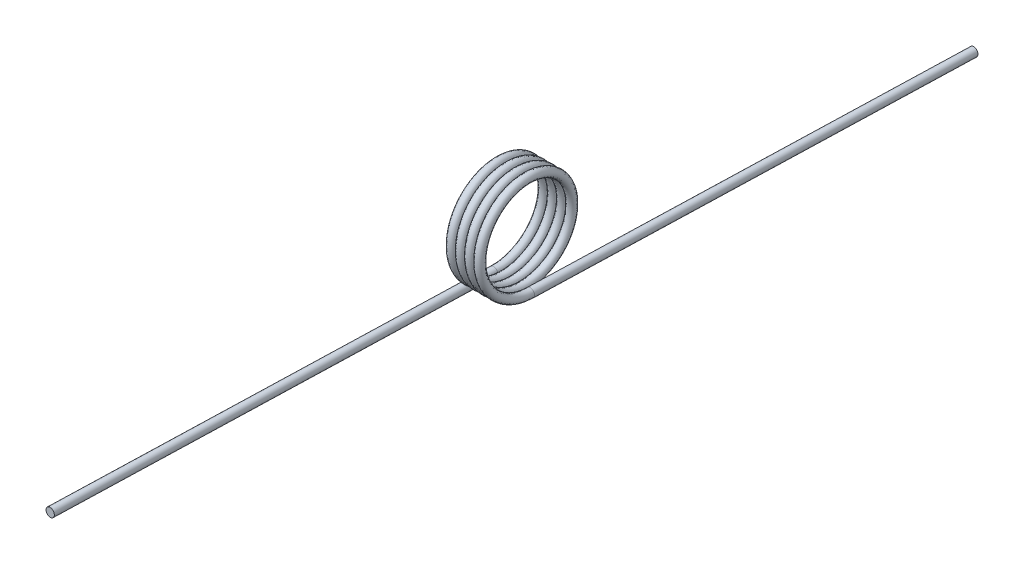
from build123d import *

# Parameters (mm, degrees)
SWEEP1_PITCH       = 0.4064
SWEEP1_HEIGHT      = 1.6256
SWEEP1_RADIUS      = 2.1336
SWEEP1_START_ANGLE = 90
SKETCH2_R          = 0.1905
SKETCH3_R          = 0.1905
EXTRUDE1_DEPTH     = 19.05
SKETCH4_R          = 0.1905
EXTRUDE2_DEPTH     = 19.05


with BuildPart() as part:
    # Sweep1: sweep along a helix
    with BuildLine() as sweep1_path:
        add(Helix(SWEEP1_PITCH, SWEEP1_HEIGHT, SWEEP1_RADIUS, center=(0, 0, 0), direction=(1, 0, 0), mode=Mode.PRIVATE).rotate(Axis((0, 0, 0), (1, 0, 0)), SWEEP1_START_ANGLE))
    # Sketch2 → Sweep1 (sweep)
    with BuildSketch(Plane(origin=(0, -2.1336, 0), x_dir=(-0.9995408099751958, 2.670968748341997e-14, -0.030301306805643583), z_dir=(0.030301306805643583, 1.0934748123692067e-14, -0.9995408099751958))):
        Circle(SKETCH2_R)
    sweep(path=sweep1_path.line, is_frenet=True)

    # Sketch3 → Extrude1 (add)
    with BuildSketch(Plane(origin=(0, 0, 0), x_dir=(0.9995408099751958, -2.668193457087813e-14, 0.03030130680564358), z_dir=(-0.03030130680564358, -1.0934748123692069e-14, 0.9995408099751958))):
        with Locations(Location((0, -2.1336, 0), (0, 0, 180))):
            Circle(SKETCH3_R)
    extrude(amount=EXTRUDE1_DEPTH)

    # Sketch4 → Extrude2 (add)
    with BuildSketch(Plane(origin=(0.001492576, 0, -0.049235186), x_dir=(-0.9958718034081837, -0.08560321398081559, -0.030190080037768047), z_dir=(0.030301306805643583, 6.677210867556127e-14, -0.9995408099751957))):
        with Locations(Location((-1.436246186, -2.264860897, 0), (0, 0, 4.910712917))):
            Circle(SKETCH4_R)
    extrude(amount=EXTRUDE2_DEPTH)


solid = part.part
